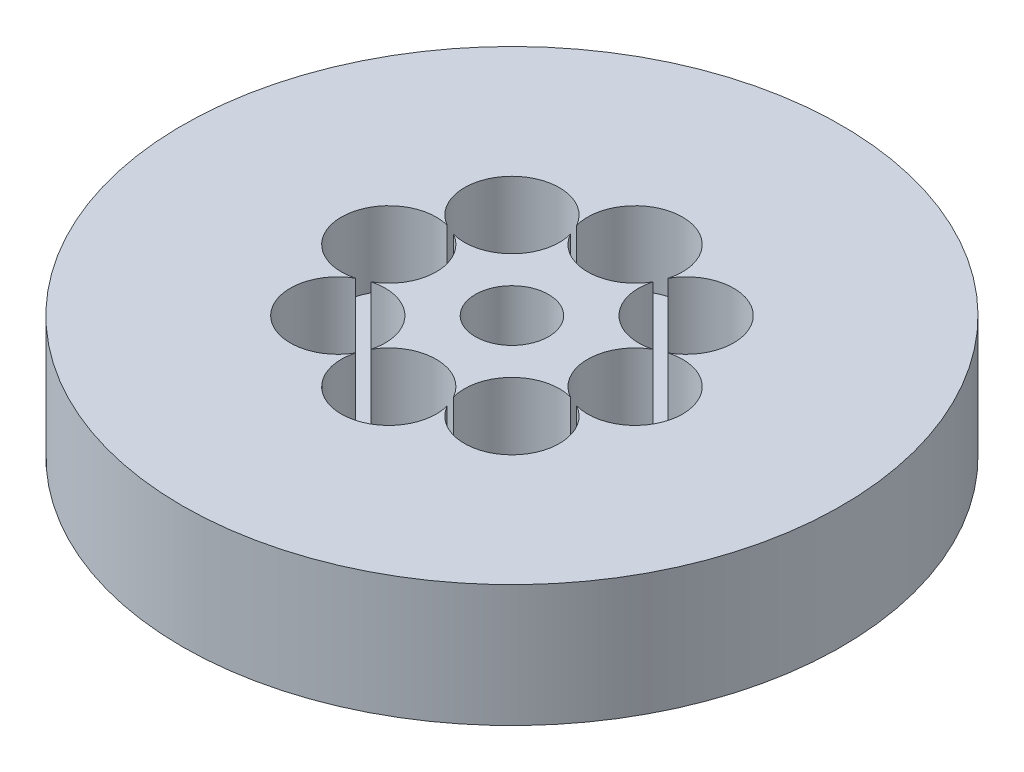
from build123d import *

# Parameters (mm, degrees)
SKETCH1_R           = 67.5
BOSS_EXTRUDE1_DEPTH = 25
SKETCH2_R           = 7.5
CUT_EXTRUDE1_DEPTH  = 99.67877178
SKETCH3_R           = 9.726631354
CUT_EXTRUDE2_DEPTH  = 15.23068031
CIRPATTERN1_COUNT   = 8


with BuildPart() as part:
    # Sketch1 → Boss-Extrude1 (new body)
    with BuildSketch(Plane(origin=(0, 0, 0), x_dir=(1, 0, 0), z_dir=(0, 1, 0))):
        Circle(SKETCH1_R)
    extrude(amount=BOSS_EXTRUDE1_DEPTH)

    # Sketch2 → Cut-Extrude1 (cut, through all)
    with BuildSketch(Plane(origin=(0, 0, 0), x_dir=(1, 0, 0), z_dir=(0, 1, 0))):
        Circle(SKETCH2_R)
    extrude(amount=CUT_EXTRUDE1_DEPTH, mode=Mode.SUBTRACT)

    # Sketch3 → Cut-Extrude2 (cut)
    with BuildSketch(Plane(origin=(0, 25, 0), x_dir=(1, 0, 0), z_dir=(0, 1, 0))):
        with Locations((-25.223681721, 0)):
            Circle(SKETCH3_R)
    cut_extrude2 = extrude(amount=-CUT_EXTRUDE2_DEPTH, mode=Mode.SUBTRACT)

    # CirPattern1: Cut-Extrude2 ×8 about axis
    cirpattern1_axis = Axis((0, 0, 0), (0, 1, 0))
    for i in range(1, CIRPATTERN1_COUNT):
        add(cut_extrude2.rotate(cirpattern1_axis, i * 360 / CIRPATTERN1_COUNT), mode=Mode.SUBTRACT)


solid = part.part
